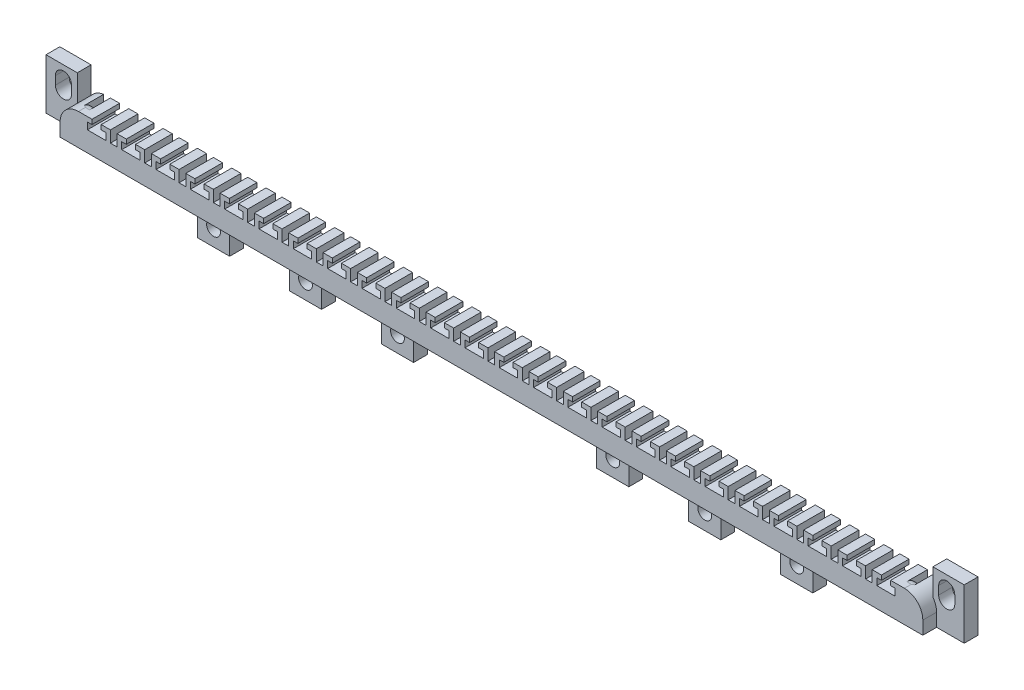
from build123d import *

# Parameters (mm, degrees)
SKETCH13_W          = 177.6636
SKETCH13_H          = 4.35
BOSS_EXTRUDE5_DEPTH = 6
BOSS_EXTRUDE6_DEPTH = 6
SKETCH20_W          = 6.998825312
SKETCH20_H          = 6.998825312
SKETCH20_R          = 1.5
SKETCH20_W_2        = 7
SKETCH20_H_2        = 7
SKETCH20_W_3        = 7.001174688
SKETCH20_H_3        = 7.001174688
BOSS_EXTRUDE7_DEPTH = 3
SKETCH25_W          = 5
SKETCH25_H          = 6.85
BOSS_EXTRUDE8_DEPTH = 6
SKETCH26_W          = 1.463634783
SKETCH26_H          = 2.5
SKETCH26_W_2        = 1.463634782
TAB_SLOTS_DEPTH     = 7.35
TAB_FILLETS_R       = 2
FILLET2_R           = 0.75
BOSS_EXTRUDE9_DEPTH = 3
FILLET4_START       = 3
FILLET4_DEPTH       = 4
FILLET4_START_2     = -1
FILLET4_2_DEPTH     = 4


with BuildPart() as part:
    # Sketch13 → Boss-Extrude5 (new body)
    with BuildSketch(Plane.XY):
        with Locations((0, -3.515)):
            Rectangle(SKETCH13_W, SKETCH13_H)
    extrude(amount=BOSS_EXTRUDE5_DEPTH)

    # Sketch15 → Boss-Extrude6 (add)
    with BuildSketch(Plane.XY.offset(6)):
        Polygon((-82.8318, -1.34), (-82.8318, 1.16), (-84.8318, 1.16), (-84.8318, 0.16), (-83.8318, 0.16), (-83.8318, -1.34), align=None)
        Polygon((-86.8318, 1.16), (-86.8318, 0.16), (-87.8318, 0.16), (-87.8318, -1.34), (-88.8318, -1.34), (-88.8318, 1.16), align=None)
        Polygon((-75.368165217, -1.34), (-75.368165217, 1.16), (-77.368165217, 1.16), (-77.368165217, 0.16), (-76.368165217, 0.16), (-76.368165217, -1.34), align=None)
        Polygon((-79.368165217, 1.16), (-79.368165217, 0.16), (-80.368165217, 0.16), (-80.368165217, -1.34), (-81.368165217, -1.34), (-81.368165217, 1.16), align=None)
        Polygon((-67.904530435, -1.34), (-67.904530435, 1.16), (-69.904530435, 1.16), (-69.904530435, 0.16), (-68.904530435, 0.16), (-68.904530435, -1.34), align=None)
        Polygon((-71.904530435, 1.16), (-71.904530435, 0.16), (-72.904530435, 0.16), (-72.904530435, -1.34), (-73.904530435, -1.34), (-73.904530435, 1.16), align=None)
        Polygon((-60.440895652, -1.34), (-60.440895652, 1.16), (-62.440895652, 1.16), (-62.440895652, 0.16), (-61.440895652, 0.16), (-61.440895652, -1.34), align=None)
        Polygon((-64.440895652, 1.16), (-64.440895652, 0.16), (-65.440895652, 0.16), (-65.440895652, -1.34), (-66.440895652, -1.34), (-66.440895652, 1.16), align=None)
        Polygon((-52.97726087, -1.34), (-52.97726087, 1.16), (-54.97726087, 1.16), (-54.97726087, 0.16), (-53.97726087, 0.16), (-53.97726087, -1.34), align=None)
        Polygon((-56.97726087, 1.16), (-56.97726087, 0.16), (-57.97726087, 0.16), (-57.97726087, -1.34), (-58.97726087, -1.34), (-58.97726087, 1.16), align=None)
        Polygon((-45.513626087, -1.34), (-45.513626087, 1.16), (-47.513626087, 1.16), (-47.513626087, 0.16), (-46.513626087, 0.16), (-46.513626087, -1.34), align=None)
        Polygon((-49.513626087, 1.16), (-49.513626087, 0.16), (-50.513626087, 0.16), (-50.513626087, -1.34), (-51.513626087, -1.34), (-51.513626087, 1.16), align=None)
        Polygon((-38.049991304, -1.34), (-38.049991304, 1.16), (-40.049991304, 1.16), (-40.049991304, 0.16), (-39.049991304, 0.16), (-39.049991304, -1.34), align=None)
        Polygon((-42.049991304, 1.16), (-42.049991304, 0.16), (-43.049991304, 0.16), (-43.049991304, -1.34), (-44.049991304, -1.34), (-44.049991304, 1.16), align=None)
        Polygon((-30.586356522, -1.34), (-30.586356522, 1.16), (-32.586356522, 1.16), (-32.586356522, 0.16), (-31.586356522, 0.16), (-31.586356522, -1.34), align=None)
        Polygon((-34.586356522, 1.16), (-34.586356522, 0.16), (-35.586356522, 0.16), (-35.586356522, -1.34), (-36.586356522, -1.34), (-36.586356522, 1.16), align=None)
        Polygon((-23.122721739, -1.34), (-23.122721739, 1.16), (-25.122721739, 1.16), (-25.122721739, 0.16), (-24.122721739, 0.16), (-24.122721739, -1.34), align=None)
        Polygon((-27.122721739, 1.16), (-27.122721739, 0.16), (-28.122721739, 0.16), (-28.122721739, -1.34), (-29.122721739, -1.34), (-29.122721739, 1.16), align=None)
        Polygon((-15.659086957, -1.34), (-15.659086957, 1.16), (-17.659086957, 1.16), (-17.659086957, 0.16), (-16.659086957, 0.16), (-16.659086957, -1.34), align=None)
        Polygon((-19.659086957, 1.16), (-19.659086957, 0.16), (-20.659086957, 0.16), (-20.659086957, -1.34), (-21.659086957, -1.34), (-21.659086957, 1.16), align=None)
        Polygon((-8.195452174, -1.34), (-8.195452174, 1.16), (-10.195452174, 1.16), (-10.195452174, 0.16), (-9.195452174, 0.16), (-9.195452174, -1.34), align=None)
        Polygon((-12.195452174, 1.16), (-12.195452174, 0.16), (-13.195452174, 0.16), (-13.195452174, -1.34), (-14.195452174, -1.34), (-14.195452174, 1.16), align=None)
        Polygon((-0.731817391, -1.34), (-0.731817391, 1.16), (-2.731817391, 1.16), (-2.731817391, 0.16), (-1.731817391, 0.16), (-1.731817391, -1.34), align=None)
        Polygon((-4.731817391, 1.16), (-4.731817391, 0.16), (-5.731817391, 0.16), (-5.731817391, -1.34), (-6.731817391, -1.34), (-6.731817391, 1.16), align=None)
        Polygon((6.731817391, -1.34), (6.731817391, 1.16), (4.731817391, 1.16), (4.731817391, 0.16), (5.731817391, 0.16), (5.731817391, -1.34), align=None)
        Polygon((2.731817391, 1.16), (2.731817391, 0.16), (1.731817391, 0.16), (1.731817391, -1.34), (0.731817391, -1.34), (0.731817391, 1.16), align=None)
        Polygon((14.195452174, -1.34), (14.195452174, 1.16), (12.195452174, 1.16), (12.195452174, 0.16), (13.195452174, 0.16), (13.195452174, -1.34), align=None)
        Polygon((10.195452174, 1.16), (10.195452174, 0.16), (9.195452174, 0.16), (9.195452174, -1.34), (8.195452174, -1.34), (8.195452174, 1.16), align=None)
        Polygon((21.659086957, -1.34), (21.659086957, 1.16), (19.659086957, 1.16), (19.659086957, 0.16), (20.659086957, 0.16), (20.659086957, -1.34), align=None)
        Polygon((17.659086957, 1.16), (17.659086957, 0.16), (16.659086957, 0.16), (16.659086957, -1.34), (15.659086957, -1.34), (15.659086957, 1.16), align=None)
        Polygon((29.122721739, -1.34), (29.122721739, 1.16), (27.122721739, 1.16), (27.122721739, 0.16), (28.122721739, 0.16), (28.122721739, -1.34), align=None)
        Polygon((25.122721739, 1.16), (25.122721739, 0.16), (24.122721739, 0.16), (24.122721739, -1.34), (23.122721739, -1.34), (23.122721739, 1.16), align=None)
        Polygon((36.586356522, -1.34), (36.586356522, 1.16), (34.586356522, 1.16), (34.586356522, 0.16), (35.586356522, 0.16), (35.586356522, -1.34), align=None)
        Polygon((32.586356522, 1.16), (32.586356522, 0.16), (31.586356522, 0.16), (31.586356522, -1.34), (30.586356522, -1.34), (30.586356522, 1.16), align=None)
        Polygon((44.049991304, -1.34), (44.049991304, 1.16), (42.049991304, 1.16), (42.049991304, 0.16), (43.049991304, 0.16), (43.049991304, -1.34), align=None)
        Polygon((40.049991304, 1.16), (40.049991304, 0.16), (39.049991304, 0.16), (39.049991304, -1.34), (38.049991304, -1.34), (38.049991304, 1.16), align=None)
        Polygon((51.513626087, -1.34), (51.513626087, 1.16), (49.513626087, 1.16), (49.513626087, 0.16), (50.513626087, 0.16), (50.513626087, -1.34), align=None)
        Polygon((47.513626087, 1.16), (47.513626087, 0.16), (46.513626087, 0.16), (46.513626087, -1.34), (45.513626087, -1.34), (45.513626087, 1.16), align=None)
        Polygon((58.97726087, -1.34), (58.97726087, 1.16), (56.97726087, 1.16), (56.97726087, 0.16), (57.97726087, 0.16), (57.97726087, -1.34), align=None)
        Polygon((54.97726087, 1.16), (54.97726087, 0.16), (53.97726087, 0.16), (53.97726087, -1.34), (52.97726087, -1.34), (52.97726087, 1.16), align=None)
        Polygon((66.440895652, -1.34), (66.440895652, 1.16), (64.440895652, 1.16), (64.440895652, 0.16), (65.440895652, 0.16), (65.440895652, -1.34), align=None)
        Polygon((62.440895652, 1.16), (62.440895652, 0.16), (61.440895652, 0.16), (61.440895652, -1.34), (60.440895652, -1.34), (60.440895652, 1.16), align=None)
        Polygon((73.904530435, -1.34), (73.904530435, 1.16), (71.904530435, 1.16), (71.904530435, 0.16), (72.904530435, 0.16), (72.904530435, -1.34), align=None)
        Polygon((69.904530435, 1.16), (69.904530435, 0.16), (68.904530435, 0.16), (68.904530435, -1.34), (67.904530435, -1.34), (67.904530435, 1.16), align=None)
        Polygon((81.368165217, -1.34), (81.368165217, 1.16), (79.368165217, 1.16), (79.368165217, 0.16), (80.368165217, 0.16), (80.368165217, -1.34), align=None)
        Polygon((77.368165217, 1.16), (77.368165217, 0.16), (76.368165217, 0.16), (76.368165217, -1.34), (75.368165217, -1.34), (75.368165217, 1.16), align=None)
        Polygon((88.8318, -1.34), (88.8318, 1.16), (86.8318, 1.16), (86.8318, 0.16), (87.8318, 0.16), (87.8318, -1.34), align=None)
        Polygon((84.8318, 1.16), (84.8318, 0.16), (83.8318, 0.16), (83.8318, -1.34), (82.8318, -1.34), (82.8318, 1.16), align=None)
    extrude(amount=-BOSS_EXTRUDE6_DEPTH)

    # Sketch20 → Boss-Extrude7 (add)
    # profile 1 of 6: a face of its own
    with BuildSketch(Plane(origin=(0, 0, 0), x_dir=(-1, 0, 0), z_dir=(0, 0, -1))):
        with Locations((-63.405372693, -9.189412656)):
            Rectangle(SKETCH20_W, SKETCH20_H)
        with Locations((-63.405372693, -9.189412656)):
            Circle(SKETCH20_R, mode=Mode.SUBTRACT)
    # profile 2 of 6: a face of its own
    with BuildSketch(Plane(origin=(0, 0, 0), x_dir=(-1, 0, 0), z_dir=(0, 0, -1))):
        with Locations((-43.405372702, -9.19)):
            Rectangle(SKETCH20_W_2, SKETCH20_H_2)
        with Locations((-43.405372702, -9.19)):
            Circle(SKETCH20_R, mode=Mode.SUBTRACT)
    # profile 3 of 6: a face of its own
    with BuildSketch(Plane(origin=(0, 0, 0), x_dir=(-1, 0, 0), z_dir=(0, 0, -1))):
        with Locations((-23.405372711, -9.190587344)):
            Rectangle(SKETCH20_W_3, SKETCH20_H_3)
        with Locations((-23.405372711, -9.190587344)):
            Circle(SKETCH20_R, mode=Mode.SUBTRACT)
    # profile 4 of 6: a face of its own
    with BuildSketch(Plane(origin=(0, 0, 0), x_dir=(-1, 0, 0), z_dir=(0, 0, -1))):
        with Locations((23.405372711, -9.190587344)):
            Rectangle(SKETCH20_W_3, SKETCH20_H_3)
        with Locations((23.405372711, -9.190587344)):
            Circle(SKETCH20_R, mode=Mode.SUBTRACT)
    # profile 5 of 6: a face of its own
    with BuildSketch(Plane(origin=(0, 0, 0), x_dir=(-1, 0, 0), z_dir=(0, 0, -1))):
        with Locations((43.405372702, -9.19)):
            Rectangle(SKETCH20_W_2, SKETCH20_H_2)
        with Locations((43.405372702, -9.19)):
            Circle(SKETCH20_R, mode=Mode.SUBTRACT)
    # profile 6 of 6: a face of its own
    with BuildSketch(Plane(origin=(0, 0, 0), x_dir=(-1, 0, 0), z_dir=(0, 0, -1))):
        with Locations((63.405372693, -9.189412656)):
            Rectangle(SKETCH20_W, SKETCH20_H)
        with Locations((63.405372693, -9.189412656)):
            Circle(SKETCH20_R, mode=Mode.SUBTRACT)
    extrude(amount=-BOSS_EXTRUDE7_DEPTH)

    # Sketch25 → Boss-Extrude8 (add)
    with BuildSketch(Plane.XY.offset(6)):
        with Locations((91.3318, -2.265)):
            Rectangle(SKETCH25_W, SKETCH25_H)
        with Locations((-91.272502953, -2.265)):
            Rectangle(SKETCH25_W, SKETCH25_H)
    extrude(amount=-BOSS_EXTRUDE8_DEPTH)

    # Sketch26 → Tab Slots (cut)
    with BuildSketch(Plane(origin=(0, 1.16, 0), x_dir=(1, 0, 0), z_dir=(0, 1, 0))):
        with Locations((82.099982608, -1.25)):
            Rectangle(SKETCH26_W, SKETCH26_H)
        with Locations((74.636347826, -1.25)):
            Rectangle(SKETCH26_W_2, SKETCH26_H)
        with Locations((67.172713044, -1.25)):
            Rectangle(SKETCH26_W, SKETCH26_H)
        with Locations((59.709078261, -1.25)):
            Rectangle(SKETCH26_W_2, SKETCH26_H)
        with Locations((52.245443479, -1.25)):
            Rectangle(SKETCH26_W, SKETCH26_H)
        with Locations((-89.563617392, -1.25)):
            Rectangle(SKETCH26_W, SKETCH26_H)
        with Locations((44.781808696, -1.25)):
            Rectangle(SKETCH26_W, SKETCH26_H)
        with Locations((37.318173913, -1.25)):
            Rectangle(SKETCH26_W_2, SKETCH26_H)
        with Locations((29.854539131, -1.25)):
            Rectangle(SKETCH26_W, SKETCH26_H)
        with Locations((22.390904348, -1.25)):
            Rectangle(SKETCH26_W_2, SKETCH26_H)
        with Locations((14.927269566, -1.25)):
            Rectangle(SKETCH26_W, SKETCH26_H)
        with Locations((7.463634782, -1.25)):
            Rectangle(SKETCH26_W, SKETCH26_H)
        with Locations((0, -1.25)):
            Rectangle(SKETCH26_W_2, SKETCH26_H)
        with Locations((-7.463634782, -1.25)):
            Rectangle(SKETCH26_W, SKETCH26_H)
        with Locations((-14.927269566, -1.25)):
            Rectangle(SKETCH26_W, SKETCH26_H)
        with Locations((-22.390904348, -1.25)):
            Rectangle(SKETCH26_W_2, SKETCH26_H)
        with Locations((-29.854539131, -1.25)):
            Rectangle(SKETCH26_W, SKETCH26_H)
        with Locations((-37.318173913, -1.25)):
            Rectangle(SKETCH26_W_2, SKETCH26_H)
        with Locations((-44.781808696, -1.25)):
            Rectangle(SKETCH26_W, SKETCH26_H)
        with Locations((-52.245443479, -1.25)):
            Rectangle(SKETCH26_W, SKETCH26_H)
        with Locations((-59.709078261, -1.25)):
            Rectangle(SKETCH26_W_2, SKETCH26_H)
        with Locations((-67.172713044, -1.25)):
            Rectangle(SKETCH26_W, SKETCH26_H)
        with Locations((-74.636347826, -1.25)):
            Rectangle(SKETCH26_W_2, SKETCH26_H)
        with Locations((-82.099982608, -1.25)):
            Rectangle(SKETCH26_W, SKETCH26_H)
        with Locations((89.563617392, -1.25)):
            Rectangle(SKETCH26_W, SKETCH26_H)
    extrude(amount=-TAB_SLOTS_DEPTH, mode=Mode.SUBTRACT)

    # Tab Fillets
    tab_fillets_edges = [part.edges().sort_by_distance(p)[0] for p in [
        (-14.927269565, -1.34, 2.5),
        (-22.390904348, -1.34, 2.5),
        (-29.85453913, -1.34, 2.5),
        (-37.318173913, -1.34, 2.5),
        (-44.781808696, -1.34, 2.5),
        (-52.245443478, -1.34, 2.5),
        (-89.563617391, 1.16, 2.5),
        (-82.099982609, -1.34, 2.5),
        (89.563617391, 1.16, 2.5),
        (-74.636347826, -1.34, 2.5),
        (-67.172713043, -1.34, 2.5),
        (-59.709078261, -1.34, 2.5),
        (-7.463634783, -1.34, 2.5),
        (0, -1.34, 2.5),
        (7.463634783, -1.34, 2.5),
        (14.927269565, -1.34, 2.5),
        (22.390904348, -1.34, 2.5),
        (29.85453913, -1.34, 2.5),
        (37.318173913, -1.34, 2.5),
        (44.781808696, -1.34, 2.5),
        (52.245443478, -1.34, 2.5),
        (59.709078261, -1.34, 2.5),
        (67.172713043, -1.34, 2.5),
        (74.636347826, -1.34, 2.5),
        (82.099982609, -1.34, 2.5),
    ]]
    fillet(tab_fillets_edges, radius=TAB_FILLETS_R)

    # Fillet2
    fillet2_edges = [part.edges().sort_by_distance(p)[0] for p in [
        (63.405372693, -5.69, 3),
        (43.405372702, -5.69, 3),
        (23.405372711, -5.69, 3),
        (-23.405372711, -5.69, 3),
        (-43.405372702, -5.69, 3),
        (-63.405372693, -5.69, 3),
    ]]
    fillet(fillet2_edges, radius=FILLET2_R)

    # Sketch27 → Boss-Extrude9 (add)
    # profile 1 of 2: a face of its own
    with BuildSketch(Plane(origin=(0, 0, 0), x_dir=(-1, 0, 0), z_dir=(0, 0, -1))):
        Polygon((-93.8318, -5.69), (-99.8318, -5.69), (-99.8318, 5.31), (-93.0318, 5.31), (-93.0318, 1.16), (-93.8318, 1.16), align=None)
        with BuildLine():
            Line((-94.2818, 2.41), (-94.2818, 0.61))
            ThreePointArc((-94.2818, 0.61), (-96.0318, -1.14), (-97.7818, 0.61))
            Line((-97.7818, 0.61), (-97.7818, 2.41))
            ThreePointArc((-97.7818, 2.41), (-96.0318, 4.16), (-94.2818, 2.41))
        make_face(mode=Mode.SUBTRACT)
    # profile 2 of 2: a face of its own
    with BuildSketch(Plane(origin=(0, 0, 0), x_dir=(-1, 0, 0), z_dir=(0, 0, -1))):
        Polygon((93.0318, 1.16), (93.0318, 5.31), (99.8318, 5.31), (99.8318, -5.69), (93.772502953, -5.69), (93.772502953, 1.16), align=None)
        with BuildLine():
            Line((94.2818, 2.41), (94.2818, 0.61))
            ThreePointArc((94.2818, 0.61), (96.0318, -1.14), (97.7818, 0.61))
            Line((97.7818, 0.61), (97.7818, 2.41))
            ThreePointArc((97.7818, 2.41), (96.0318, 4.16), (94.2818, 2.41))
        make_face(mode=Mode.SUBTRACT)
    extrude(amount=-BOSS_EXTRUDE9_DEPTH)

    # Fillet4: read off the stored shape, not the designer's step
    # Fillet4 outline → Fillet4 (cut)
    with BuildSketch(Plane.XY.offset(FILLET4_START)):
        with BuildLine():
            Line((93.8318, 1.16), (89.8318, 1.16))
            ThreePointArc((89.8318, 1.16), (92.660227125, -0.011572875), (93.8318, -2.84))
            Line((93.8318, -2.84), (93.8318, 1.16))
        make_face()
        with BuildLine():
            Line((-89.772502953, 1.16), (-93.772502953, 1.16))
            Line((-93.772502953, 1.16), (-93.772502953, -2.84))
            ThreePointArc((-93.772502953, -2.84), (-92.600930078, -0.011572875), (-89.772502953, 1.16))
        make_face()
    extrude(amount=FILLET4_DEPTH, mode=Mode.SUBTRACT)

    # Fillet4 2 outline → Fillet4 2 (cut)
    with BuildSketch(Plane.XY.offset(FILLET4_START_2)):
        with BuildLine():
            Line((93.0318, -0.44), (93.0318, 1.16))
            Line((93.0318, 1.16), (89.8318, 1.16))
            ThreePointArc((89.8318, 1.16), (91.620654382, 0.737708764), (93.0318, -0.44))
        make_face()
        with BuildLine():
            Line((-89.772502953, 1.16), (-93.0318, 1.16))
            Line((-93.0318, 1.16), (-93.0318, -0.521167802))
            ThreePointArc((-93.0318, -0.521167802), (-91.606170209, 0.714949282), (-89.772502953, 1.16))
        make_face()
    extrude(amount=FILLET4_2_DEPTH, mode=Mode.SUBTRACT)


solid = part.part
